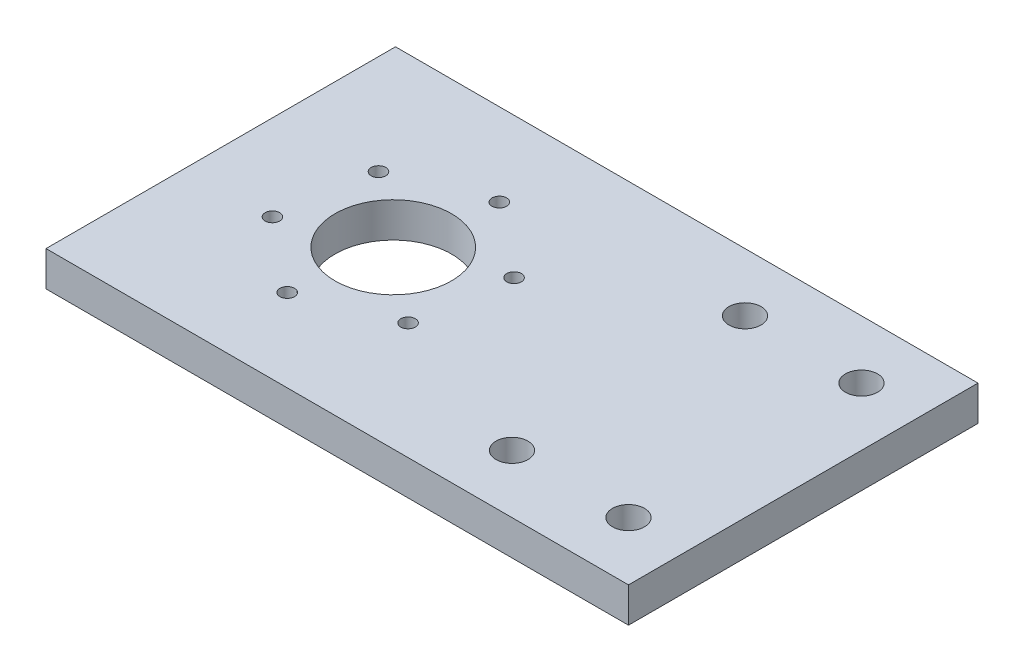
from build123d import *

# Parameters (mm, degrees)
SKETCH1_W           = 100
SKETCH1_H           = 60
BOSS_EXTRUDE1_DEPTH = 6
SKETCH2_R           = 10
SKETCH2_R_2         = 2.75
CUT_EXTRUDE1_DEPTH  = 6
SKETCH3_R           = 1.25
CUT_EXTRUDE2_DEPTH  = 117.773284616


with BuildPart() as part:
    # Sketch1 → Boss-Extrude1 (new body)
    with BuildSketch(Plane(origin=(0, 0, 0), x_dir=(1, 0, 0), z_dir=(0, 1, 0))):
        with Locations((50, 30)):
            Rectangle(SKETCH1_W, SKETCH1_H)
    extrude(amount=BOSS_EXTRUDE1_DEPTH)

    # Sketch2 → Cut-Extrude1 (cut)
    with BuildSketch(Plane(origin=(0, 6, 0), x_dir=(1, 0, 0), z_dir=(0, 1, 0))):
        with Locations((29.615341175, 30)):
            Circle(SKETCH2_R)
        with Locations((70, 50)):
            Circle(SKETCH2_R_2)
        with Locations((90, 50)):
            Circle(SKETCH2_R_2)
        with Locations((70, 10)):
            Circle(SKETCH2_R_2)
        with Locations((90, 10)):
            Circle(SKETCH2_R_2)
    extrude(amount=-CUT_EXTRUDE1_DEPTH, mode=Mode.SUBTRACT)

    # Sketch3 → Cut-Extrude2 (cut, through all)
    with BuildSketch(Plane(origin=(0, 6, 0), x_dir=(1, 0, 0), z_dir=(0, 1, 0))):
        with Locations((31.998383025, 45.821539481)):
            Circle(SKETCH3_R)
        with Locations((17.105006983, 39.97454452)):
            Circle(SKETCH3_R)
        with Locations((44.508717217, 35.846994961)):
            Circle(SKETCH3_R)
        with Locations((14.721965133, 24.153005039)):
            Circle(SKETCH3_R)
        with Locations((27.232299326, 14.178460519)):
            Circle(SKETCH3_R)
        with Locations((42.125675368, 20.02545548)):
            Circle(SKETCH3_R)
    extrude(amount=-CUT_EXTRUDE2_DEPTH, mode=Mode.SUBTRACT)


solid = part.part
